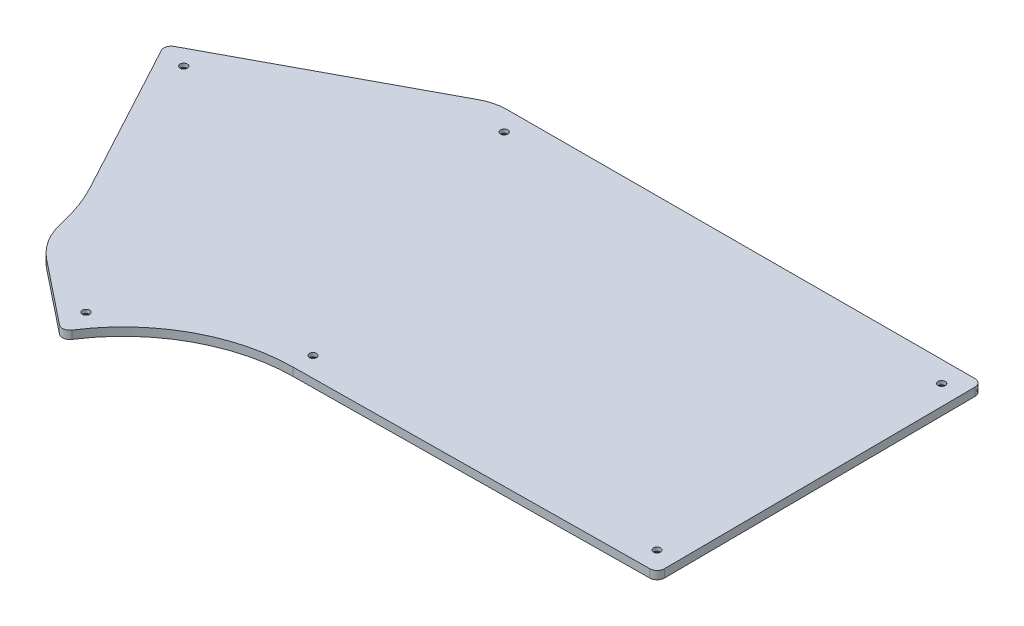
from build123d import *

# Parameters (mm, degrees)
SKETCH1_R           = 1.35
BOSS_EXTRUDE1_DEPTH = 3
SKETCH2_R           = 2.5
CUT_EXTRUDE1_DEPTH  = 1.7
CHAMFER1_SIZE       = 1.2


with BuildPart() as part:
    # Sketch1 → Boss-Extrude1 (new body)
    with BuildSketch(Plane(origin=(0, 0, 0), x_dir=(1, 0, 0), z_dir=(0, 1, 0))):
        with BuildLine():
            Line((134.161534911, 59.43281878), (-37.78892646, 59.059864213))
            add(Edge.make_bspline(
                [(-37.78892646, 59.059864213), (-39.260373987, 59.056672695), (-40.726264192, 58.873631016), (-42.864744181, 58.335544499), (-43.56477321, 58.113464931), (-44.928422176, 57.586554564), (-45.593707509, 57.281316649), (-46.242490458, 56.934388883)],
                knots=[0, 0, 0, 0, 0.5, 0.5, 0.75, 0.75, 1, 1, 1, 1], degree=3))
            Line((-46.242490458, 56.934388883), (-119.214433491, 17.913645156))
            add(Edge.make_bspline(
                [(-119.214433491, 17.913645156), (-119.371714153, 17.829541484), (-119.518068848, 17.731347507), (-119.789747392, 17.507837833), (-119.916274323, 17.380912308), (-120.139852202, 17.106706149), (-120.236961752, 16.960118582), (-120.402064762, 16.648131274), (-120.469932783, 16.481746722), (-120.570167022, 16.144162456), (-120.603591555, 15.971345529), (-120.63629684, 15.61747918), (-120.635015098, 15.439777034), (-120.598507798, 15.090011023), (-120.562994402, 14.91558609), (-120.458204018, 14.575953541), (-120.389758062, 14.412551149), (-120.305177563, 14.255596117)],
                knots=[0, 0, 0, 0, 0.125, 0.125, 0.25, 0.25, 0.375, 0.375, 0.5, 0.5, 0.625, 0.625, 0.75, 0.75, 0.875, 0.875, 1, 1, 1, 1], degree=3))
            Line((-120.305177563, 14.255596117), (-89.830246023, -42.296373733))
            add(Edge.make_bspline(
                [(-89.830246023, -42.296373733), (-88.375146858, -44.996584036), (-87.11307972, -47.796479497), (-84.994631409, -53.553509169), (-84.143686828, -56.492865486), (-83.501659246, -59.49224952)],
                knots=[0, 0, 0, 0, 0.5, 0.5, 1, 1, 1, 1], degree=3))
            add(Edge.make_bspline(
                [(-83.501659246, -59.49224952), (-83.207913745, -60.86455126), (-82.798283173, -62.200751268), (-82.010871212, -64.151167066), (-81.721235964, -64.787858992), (-81.092273153, -66.026650793), (-80.072714097, -67.836944856), (-78.830441112, -69.507100935), (-76.968111095, -71.604375976), (-75.952258591, -72.567256281), (-74.854523467, -73.441463587)],
                knots=[0, 0, 0, 0, 0.25, 0.25, 0.375, 0.375, 0.5, 0.75, 0.75, 1, 1, 1, 1], degree=3))
            Line((-74.854523467, -73.441463587), (-51.539950225, -92.008574916))
            add(Edge.make_bspline(
                [(-51.539950225, -92.008574916), (-51.390987712, -92.127204734), (-51.232429983, -92.228435853), (-50.896866499, -92.397446873), (-50.717603486, -92.465650862), (-50.353220614, -92.562423021), (-50.167823032, -92.591707222), (-49.790547653, -92.611667192), (-49.599550596, -92.601753163), (-49.228628709, -92.543472736), (-49.045331803, -92.494850179), (-48.690867071, -92.359239211), (-48.52347813, -92.273968718), (-48.207935535, -92.069298914), (-48.058689904, -91.948371285), (-47.792751324, -91.681532762), (-47.674455998, -91.534984666), (-47.571321486, -91.374872149)],
                knots=[0, 0, 0, 0, 0.125, 0.125, 0.25, 0.25, 0.375, 0.375, 0.5, 0.5, 0.625, 0.625, 0.75, 0.75, 0.875, 0.875, 1, 1, 1, 1], degree=3))
            add(Edge.make_bspline(
                [(-47.571321486, -91.374872149), (-46.153036919, -89.173037798), (-44.608917961, -87.076393648), (-41.274741201, -83.088695854), (-39.484564632, -81.197538353), (-35.653029438, -77.626010441), (-33.646571022, -75.978127616), (-29.459465947, -72.9471878), (-27.278793496, -71.564170023), (-23.876425351, -69.689354772), (-22.720413119, -69.097695924), (-20.363479447, -67.982655618), (-19.159804228, -67.458437514), (-15.529771039, -66.009292146), (-10.611085077, -64.391548948), (-5.539520445, -63.385094495), (-1.677546074, -62.863371081), (-0.379428844, -62.728223796), (2.232268288, -62.538422964), (3.539898616, -62.484137167), (4.849299501, -62.470210553)],
                knots=[0, 0, 0, 0, 0.125, 0.125, 0.25, 0.25, 0.375, 0.375, 0.5, 0.5, 0.5625, 0.5625, 0.625, 0.625, 0.75, 0.875, 0.875, 0.9375, 0.9375, 1, 1, 1, 1], degree=3))
            Line((4.849299501, -62.470210553), (134.990197336, -61.08604937))
            add(Edge.make_bspline(
                [(134.990197336, -61.08604937), (135.167346788, -61.084165224), (135.341361144, -61.064937541), (135.683502878, -60.993915065), (135.853395352, -60.941308848), (136.17721181, -60.80435926), (136.330630434, -60.720947254), (136.620639449, -60.524514457), (136.757918371, -60.410322016), (137.003647924, -60.161160095), (137.113655434, -60.025415528), (137.307455362, -59.731164559), (137.38973844, -59.574273341), (137.586799708, -59.088862557), (137.655136112, -58.736369262), (137.652832045, -58.382163441)],
                knots=[0, 0, 0, 0, 0.125, 0.125, 0.25, 0.25, 0.375, 0.375, 0.5, 0.5, 0.625, 0.625, 0.75, 0.75, 1, 1, 1, 1], degree=3))
            Line((137.652832045, -58.382163441), (136.904111112, 56.7188799))
            add(Edge.make_bspline(
                [(136.904111112, 56.7188799), (136.902940109, 56.898896811), (136.883766744, 57.075714075), (136.811945539, 57.42339902), (136.758448028, 57.596083274), (136.619240417, 57.924944469), (136.534418559, 58.080811621), (136.334727886, 58.375638017), (136.21883457, 58.51509664), (135.966139935, 58.765058133), (135.828467671, 58.877195989), (135.529967832, 59.07521276), (135.371179474, 59.159347789), (134.879114282, 59.361936915), (134.521405548, 59.433599309), (134.161534911, 59.43281878)],
                knots=[0, 0, 0, 0, 0.125, 0.125, 0.25, 0.25, 0.375, 0.375, 0.5, 0.5, 0.625, 0.625, 0.75, 0.75, 1, 1, 1, 1], degree=3))
        make_face()
        with Locations(Location((129.627717634, 51.726368816, 0), (0, 0, 270))):
            Circle(SKETCH1_R, mode=Mode.SUBTRACT)
        with Locations(Location((-31.164469896, 51.377616083, 0), (0, 0, 270))):
            Circle(SKETCH1_R, mode=Mode.SUBTRACT)
        with Locations(Location((-111.171184663, 13.369593003, 0), (0, 0, 270))):
            Circle(SKETCH1_R, mode=Mode.SUBTRACT)
        with Locations(Location((-50.65856493, -83.119927605, 0), (0, 0, 270))):
            Circle(SKETCH1_R, mode=Mode.SUBTRACT)
        with Locations(Location((4.947352904, -55.127624349, 0), (0, 0, 270))):
            Circle(SKETCH1_R, mode=Mode.SUBTRACT)
        with Locations(Location((130.314118933, -53.794240193, 0), (0, 0, 270))):
            Circle(SKETCH1_R, mode=Mode.SUBTRACT)
    extrude(amount=-BOSS_EXTRUDE1_DEPTH)

    # Sketch2 → Cut-Extrude1 (cut)
    with BuildSketch(Plane.XZ.offset(3)):
        with Locations(Location((-50.65856493, 83.119927605, 0), (0, 0, 270))):
            Circle(SKETCH2_R)
        with Locations(Location((4.947352904, 55.127624349, 0), (0, 0, 270))):
            Circle(SKETCH2_R)
        with Locations(Location((130.314118933, 53.794240193, 0), (0, 0, 270))):
            Circle(SKETCH2_R)
        with Locations(Location((129.627717634, -51.726368816, 0), (0, 0, 270))):
            Circle(SKETCH2_R)
        with Locations(Location((-31.164469896, -51.377616083, 0), (0, 0, 270))):
            Circle(SKETCH2_R)
        with Locations(Location((-111.171184663, -13.369593003, 0), (0, 0, 270))):
            Circle(SKETCH2_R)
    extrude(amount=-CUT_EXTRUDE1_DEPTH, mode=Mode.SUBTRACT)

    # Chamfer1
    # the kernel refuses this chamfer: 1.2 mm, written as the material it adds along each edge
    with BuildSketch(Plane(origin=(129.627717634, -1.3, -51.726368816), x_dir=(0, 0, -1), z_dir=(-1, 0, 0))) as chamfer1_piece_1_section:
        Polygon((2.5, CHAMFER1_SIZE), (2.5 - CHAMFER1_SIZE, 0), (2.5, 0), align=None)
    chamfer1_piece_1 = revolve(axis=Axis((129.627717634, -1.3, -51.726368816), (0, -1, 0)), mode=Mode.PRIVATE)
    chamfer1_piece_1 = chamfer1_piece_1 - Plane(origin=(129.627717634, -1.926520071, -51.726368816), x_dir=(0, 0, 1), z_dir=(0, 1, 0)) * Cylinder(1.35, 10, mode=Mode.PRIVATE)
    add(chamfer1_piece_1)
    with BuildSketch(Plane(origin=(130.314118933, -1.3, 53.794240193), x_dir=(0, 0, -1), z_dir=(-1, 0, 0))) as chamfer1_piece_2_section:
        Polygon((2.5, CHAMFER1_SIZE), (2.5 - CHAMFER1_SIZE, 0), (2.5, 0), align=None)
    chamfer1_piece_2 = revolve(axis=Axis((130.314118933, -1.3, 53.794240193), (0, -1, 0)), mode=Mode.PRIVATE)
    chamfer1_piece_2 = chamfer1_piece_2 - Plane(origin=(130.314118933, -1.926520071, 53.794240193), x_dir=(0, 0, 1), z_dir=(0, 1, 0)) * Cylinder(1.35, 10, mode=Mode.PRIVATE)
    add(chamfer1_piece_2)
    with BuildSketch(Plane(origin=(4.947352904, -1.3, 55.127624349), x_dir=(0, 0, -1), z_dir=(-1, 0, 0))) as chamfer1_piece_3_section:
        Polygon((2.5, CHAMFER1_SIZE), (2.5 - CHAMFER1_SIZE, 0), (2.5, 0), align=None)
    chamfer1_piece_3 = revolve(axis=Axis((4.947352904, -1.3, 55.127624349), (0, -1, 0)), mode=Mode.PRIVATE)
    chamfer1_piece_3 = chamfer1_piece_3 - Plane(origin=(4.947352904, -1.926520071, 55.127624349), x_dir=(0, 0, 1), z_dir=(0, 1, 0)) * Cylinder(1.35, 11, mode=Mode.PRIVATE)
    add(chamfer1_piece_3)
    with BuildSketch(Plane(origin=(-50.65856493, -1.3, 83.119927605), x_dir=(0, 0, -1), z_dir=(-1, 0, 0))) as chamfer1_piece_4_section:
        Polygon((2.5, CHAMFER1_SIZE), (2.5 - CHAMFER1_SIZE, 0), (2.5, 0), align=None)
    chamfer1_piece_4 = revolve(axis=Axis((-50.65856493, -1.3, 83.119927605), (0, -1, 0)), mode=Mode.PRIVATE)
    chamfer1_piece_4 = chamfer1_piece_4 - Plane(origin=(-50.65856493, -1.926520071, 83.119927605), x_dir=(0, 0, 1), z_dir=(0, 1, 0)) * Cylinder(1.35, 10, mode=Mode.PRIVATE)
    add(chamfer1_piece_4)
    with BuildSketch(Plane(origin=(-111.171184663, -1.3, -13.369593003), x_dir=(0, 0, -1), z_dir=(-1, 0, 0))) as chamfer1_piece_5_section:
        Polygon((2.5, CHAMFER1_SIZE), (2.5 - CHAMFER1_SIZE, 0), (2.5, 0), align=None)
    chamfer1_piece_5 = revolve(axis=Axis((-111.171184663, -1.3, -13.369593003), (0, -1, 0)), mode=Mode.PRIVATE)
    chamfer1_piece_5 = chamfer1_piece_5 - Plane(origin=(-111.171184663, -1.926520071, -13.369593003), x_dir=(0, 0, 1), z_dir=(0, 1, 0)) * Cylinder(1.35, 10, mode=Mode.PRIVATE)
    add(chamfer1_piece_5)
    with BuildSketch(Plane(origin=(-31.164469896, -1.3, -51.377616083), x_dir=(0, 0, -1), z_dir=(-1, 0, 0))) as chamfer1_piece_6_section:
        Polygon((2.5, CHAMFER1_SIZE), (2.5 - CHAMFER1_SIZE, 0), (2.5, 0), align=None)
    chamfer1_piece_6 = revolve(axis=Axis((-31.164469896, -1.3, -51.377616083), (0, -1, 0)), mode=Mode.PRIVATE)
    chamfer1_piece_6 = chamfer1_piece_6 - Plane(origin=(-31.164469896, -1.926520071, -51.377616083), x_dir=(0, 0, 1), z_dir=(0, 1, 0)) * Cylinder(1.35, 10, mode=Mode.PRIVATE)
    add(chamfer1_piece_6)


solid = part.part
